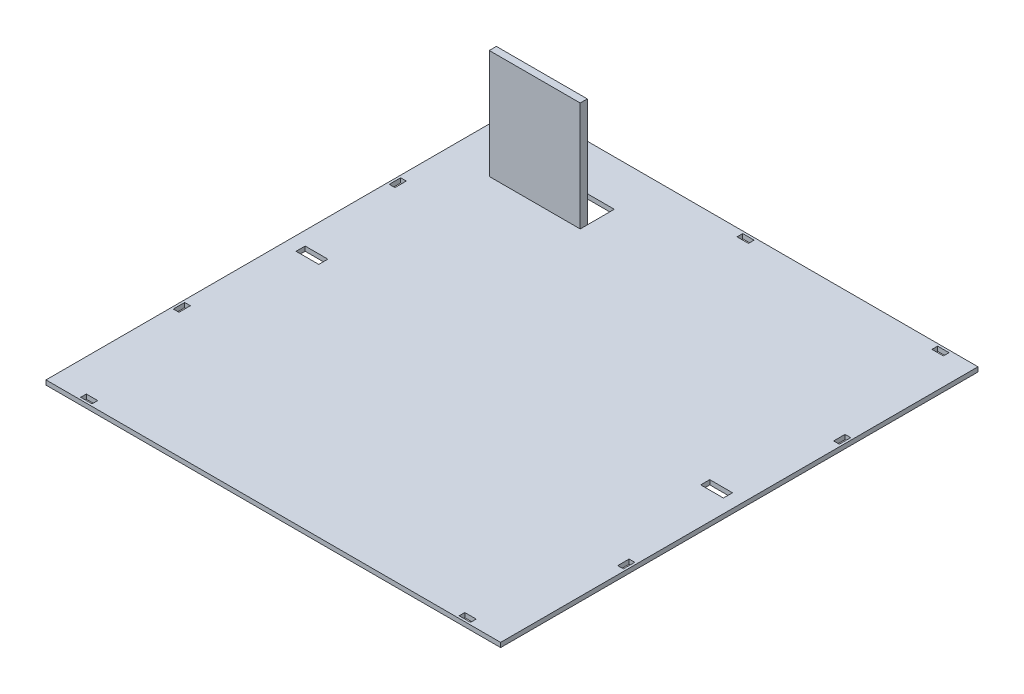
from build123d import *

# Parameters (mm, degrees)
SKETCH1_W           = 200
SKETCH1_H           = 210
SKETCH1_W_2         = 5
SKETCH1_H_2         = 2.5
SKETCH1_W_3         = 2.5
SKETCH1_H_3         = 5
SKETCH1_W_4         = 10
SKETCH1_H_4         = 4
MAINBODY_DEPTH      = 2
SKETCH1_8_W         = 40
SKETCH1_8_H         = 3.124603495
BOSS_EXTRUDE1_DEPTH = 50


with BuildPart() as part:
    # Sketch1 → MainBody (new body)
    with BuildSketch(Plane(origin=(0, 0, 0), x_dir=(1, 0, 0), z_dir=(0, 1, 0))):
        Rectangle(SKETCH1_W, SKETCH1_H)
        with Locations((-83.25, -102.75)):
            Rectangle(SKETCH1_W_2, SKETCH1_H_2, mode=Mode.SUBTRACT)
        with Locations((-97.75, -47.5)):
            Rectangle(SKETCH1_W_3, SKETCH1_H_3, mode=Mode.SUBTRACT)
        with Locations((83.25, -102.75)):
            Rectangle(SKETCH1_W_2, SKETCH1_H_2, mode=Mode.SUBTRACT)
        with Locations((97.75, -47.5)):
            Rectangle(SKETCH1_W_3, SKETCH1_H_3, mode=Mode.SUBTRACT)
        with Locations((-89, 1)):
            Rectangle(SKETCH1_W_4, SKETCH1_H_4, mode=Mode.SUBTRACT)
        with Locations((-97.75, 47.5)):
            Rectangle(SKETCH1_W_3, SKETCH1_H_3, mode=Mode.SUBTRACT)
        Polygon((-80, 70), (-80, 73.124603495), (-80, 85), (-40, 85), (-40, 73.124603495), (-40, 70), align=None, mode=Mode.SUBTRACT)
        with Locations((-83.25, 102.75)):
            Rectangle(SKETCH1_W_2, SKETCH1_H_2, mode=Mode.SUBTRACT)
        with Locations((0, 102.75)):
            Rectangle(SKETCH1_W_2, SKETCH1_H_2, mode=Mode.SUBTRACT)
        with Locations((89, 1)):
            Rectangle(SKETCH1_W_4, SKETCH1_H_4, mode=Mode.SUBTRACT)
        with Locations((97.75, 47.5)):
            Rectangle(SKETCH1_W_3, SKETCH1_H_3, mode=Mode.SUBTRACT)
        with Locations((85.75, 102.75)):
            Rectangle(SKETCH1_W_2, SKETCH1_H_2, mode=Mode.SUBTRACT)
    extrude(amount=MAINBODY_DEPTH)

    # Sketch1<8> → Boss-Extrude1 (add)
    with BuildSketch(Plane(origin=(0, 0, 0), x_dir=(1, 0, 0), z_dir=(0, 1, 0))):
        with Locations((-60, 71.562301748)):
            Rectangle(SKETCH1_8_W, SKETCH1_8_H)
    extrude(amount=BOSS_EXTRUDE1_DEPTH)


solid = part.part
